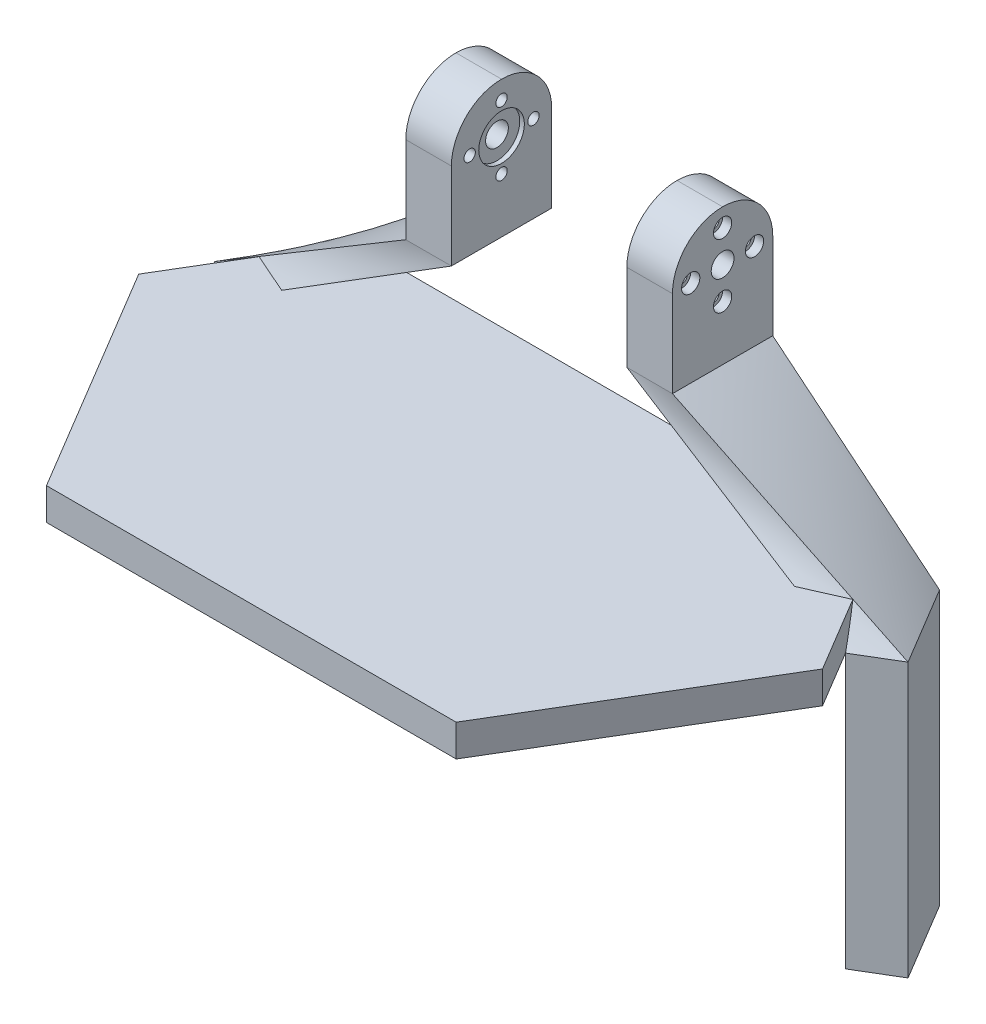
from build123d import *

# Parameters (mm, degrees)
BOSS_EXTRUDE1_DEPTH     = 60
BOSS_EXTRUDE1_2_DEPTH   = 60
BOSS_EXTRUDE2_START     = 30
SKETCH5_W               = 10
SKETCH5_H               = 22
BOSS_EXTRUDE2_DEPTH     = 30
FILLET1_R               = 11
FILLET2_R               = 11
BOSS_EXTRUDE5_DEPTH     = 7
SKETCH12_R              = 5
SKETCH12_R_2            = 2.5
CUT_EXTRUDE1_DEPTH      = 1
SKETCH12_3_R            = 2.5
CUT_EXTRUDE2_DEPTH      = 3
CUT_EXTRUDE8_DEPTH      = 165.032898367
CUT_EXTRUDE8_DEPTH_BACK = 165.032898367
SKETCH16_R              = 2.5
SKETCH17_R              = 1.25
CUT_EXTRUDE9_DEPTH      = 171.03972178
SKETCH17_3_R            = 2
SKETCH17_3_R_2          = 1.25
CUT_EXTRUDE10_DEPTH     = 2


with BuildPart() as part:
    # Sketch4 → Boss-Extrude1 (new body)
    with BuildSketch(Plane(origin=(0, 0, 0), x_dir=(1, 0, 0), z_dir=(0, 1, 0))):
        Polygon((67.506640691, -56.405895144), (76.090203327, -51.275353996), (65.82912103, -34.108228724), (57.245558394, -39.238769873), align=None)
    extrude(amount=-BOSS_EXTRUDE1_DEPTH)



with BuildPart() as body_2:
    # Sketch4 → Boss-Extrude1 2 (new body)
    with BuildSketch(Plane(origin=(0, 0, 0), x_dir=(1, 0, 0), z_dir=(0, 1, 0))):
        Polygon((-57.245558394, -39.238769873), (-67.506640691, -56.405895144), (-76.090203327, -51.275353996), (-65.82912103, -34.108228724), align=None)
    extrude(amount=-BOSS_EXTRUDE1_2_DEPTH)



with BuildPart() as body_3:
    # Sketch5 → Boss-Extrude2 (new body)
    with BuildSketch(Plane(origin=(0, 0, 0), x_dir=(1, 0, 0), z_dir=(0, 1, 0)).offset(BOSS_EXTRUDE2_START)):
        with Locations((-24.245558394, -45.108228724)):
            Rectangle(SKETCH5_W, SKETCH5_H)
    extrude(amount=BOSS_EXTRUDE2_DEPTH)


with BuildPart() as body_2_1:
    add(body_2.part)

    add(body_3.part)  # loft1 joins it to this body
    # loft from a face of the part (loft1)
    loft([body_2_1.faces().sort_by_distance((-66.667880861, 0, 45.257061934))[0], body_2_1.faces().sort_by_distance((-24.245558394, 30, 45.108228724))[0]])


with BuildPart() as body_3_2:
    # Mirror1: mirrored copy
    add(body_2_1.part.mirror(Plane(origin=(0, 0, 0), x_dir=(0, 0, 1), z_dir=(1, 0, 0))))

    # Fillet2
    fillet2_edges = [body_3_2.edges().sort_by_distance(p)[0] for p in [
        (24.245558394, 60, 34.108228724),
        (24.245558394, 60, 56.108228724),
    ]]
    fillet(fillet2_edges, radius=FILLET2_R - 0.0001)  # a hair under: the kernel refuses the full size


with BuildPart() as body_2_2:
    add(body_2_1.part)

    # Fillet1
    fillet1_edges = [body_2_2.edges().sort_by_distance(p)[0] for p in [
        (-24.245558394, 60, 34.108228724),
        (-24.245558394, 60, 56.108228724),
    ]]
    fillet(fillet1_edges, radius=FILLET1_R - 0.0001)  # a hair under: the kernel refuses the full size


with BuildPart() as part_1:
    add(part.part)

    add(body_2_2.part)  # Boss-Extrude5 merges body 2

    add(body_3_2.part)  # Boss-Extrude5 merges body 3 2
    # Sketch11 → Boss-Extrude5 (add)
    with BuildSketch(Plane(origin=(0, 0, 0), x_dir=(1, 0, 0), z_dir=(0, 1, 0))):
        Polygon((75, -68.942529607), (44.93708309, -119.238769873), (-44.93708309, -119.238769873), (-75, -68.942529607), (-57.245558394, -39.238769873), (57.245558394, -39.238769873), align=None)
    extrude(amount=BOSS_EXTRUDE5_DEPTH)

    # Sketch12 → Cut-Extrude1 (cut)
    with BuildSketch(Plane.ZY.offset(-19.245558394)):
        with Locations((45.108228724, 49)):
            Circle(SKETCH12_R)
        with Locations((45.108228724, 49)):
            Circle(SKETCH12_R_2, mode=Mode.SUBTRACT)
    cut_extrude1 = extrude(amount=-CUT_EXTRUDE1_DEPTH, mode=Mode.SUBTRACT)

    # Sketch12<3> → Cut-Extrude2 (cut)
    with BuildSketch(Plane.ZY.offset(-19.245558394)):
        with Locations((45.108228724, 49)):
            Circle(SKETCH12_3_R)
    cut_extrude2 = extrude(amount=-CUT_EXTRUDE2_DEPTH, mode=Mode.SUBTRACT)

    # Sketch16 → Cut-Extrude8 (cut, two sides: drawn at the far end of the back side and taken through both)
    with BuildSketch(Plane.ZY.offset(-19.245558394).offset(-CUT_EXTRUDE8_DEPTH_BACK)):
        with Locations((45.108228724, 49)):
            Circle(SKETCH16_R)
    extrude(amount=CUT_EXTRUDE8_DEPTH + CUT_EXTRUDE8_DEPTH_BACK, mode=Mode.SUBTRACT)

    # Sketch17 → Cut-Extrude9 (cut, through all)
    with BuildSketch(Plane(origin=(29.245558394, 0, 0), x_dir=(0, 0, -1), z_dir=(1, 0, 0))):
        with Locations((-38.108228724, 49)):
            Circle(SKETCH17_R)
        with BuildLine():
            ThreePointArc((-45.108228724, 57.25), (-46.358228724, 56), (-45.108228724, 54.75))
            Line((-45.108228724, 54.75), (-45.108228724, 57.25))
        make_face()
        with BuildLine():
            Line((-45.108228724, 57.25), (-45.108228724, 54.75))
            ThreePointArc((-45.108228724, 54.75), (-44.224345248, 55.116116524), (-43.858228724, 56))
            ThreePointArc((-43.858228724, 56), (-44.224345248, 56.883883476), (-45.108228724, 57.25))
        make_face()
        with Locations((-52.108228724, 49)):
            Circle(SKETCH17_R)
        with Locations((-45.108228724, 42)):
            Circle(SKETCH17_R)
    extrude(amount=-CUT_EXTRUDE9_DEPTH, mode=Mode.SUBTRACT)

    # Sketch17<3> → Cut-Extrude10 (cut)
    # profile 1 of 4: a face of its own
    with BuildSketch(Plane(origin=(29.245558394, 0, 0), x_dir=(0, 0, -1), z_dir=(1, 0, 0))):
        with Locations((-45.108228724, 56)):
            Circle(SKETCH17_3_R)
        with Locations((-45.108228724, 56)):
            Circle(SKETCH17_3_R_2, mode=Mode.SUBTRACT)
    # profile 2 of 4: a face of its own
    with BuildSketch(Plane(origin=(29.245558394, 0, 0), x_dir=(0, 0, -1), z_dir=(1, 0, 0))):
        with Locations((-38.108228724, 49)):
            Circle(SKETCH17_3_R)
        with Locations((-38.108228724, 49)):
            Circle(SKETCH17_3_R_2, mode=Mode.SUBTRACT)
    # profile 3 of 4: a face of its own
    with BuildSketch(Plane(origin=(29.245558394, 0, 0), x_dir=(0, 0, -1), z_dir=(1, 0, 0))):
        with Locations((-45.108228724, 42)):
            Circle(SKETCH17_3_R)
        with Locations((-45.108228724, 42)):
            Circle(SKETCH17_3_R_2, mode=Mode.SUBTRACT)
    # profile 4 of 4: a face of its own
    with BuildSketch(Plane(origin=(29.245558394, 0, 0), x_dir=(0, 0, -1), z_dir=(1, 0, 0))):
        with Locations((-52.108228724, 49)):
            Circle(SKETCH17_3_R)
        with Locations((-52.108228724, 49)):
            Circle(SKETCH17_3_R_2, mode=Mode.SUBTRACT)
    cut_extrude10 = extrude(amount=-CUT_EXTRUDE10_DEPTH, mode=Mode.SUBTRACT)

    # Mirror3: Cut-Extrude1, Cut-Extrude2, Cut-Extrude10 across plane
    add(cut_extrude1.mirror(Plane.ZY), mode=Mode.SUBTRACT)
    add(cut_extrude2.mirror(Plane.ZY), mode=Mode.SUBTRACT)
    add(cut_extrude10.mirror(Plane.ZY), mode=Mode.SUBTRACT)


solid = part_1.part
